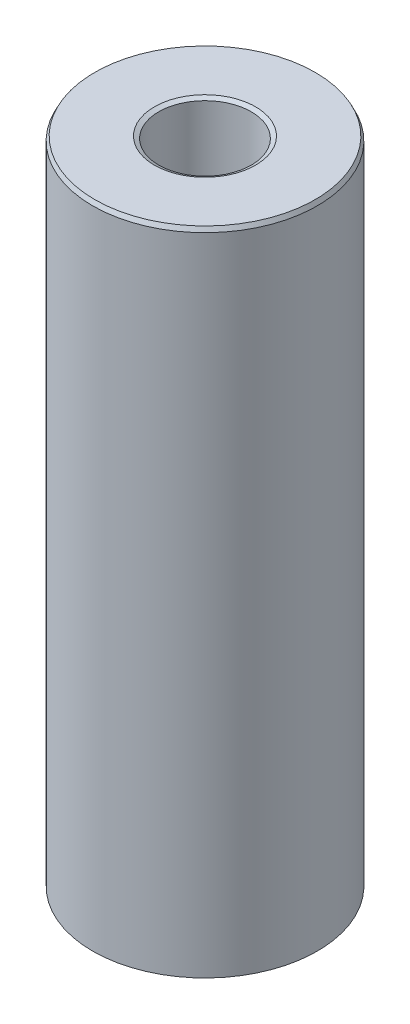
from build123d import *
from OCP.BRepFilletAPI import BRepFilletAPI_MakeChamfer

# Parameters (mm, degrees)
SKETCH1_R           = 32.5
BOSS_EXTRUDE1_DEPTH = 188.569213853
SKETCH2_R           = 13.38316823
CUT_EXTRUDE1_DEPTH  = 195.089794716
CHAMFER1_SIZE       = 1.249627912
CHAMFER1_SIZE2      = 0.614177343


with BuildPart() as part:
    # Sketch1 → Boss-Extrude1 (new body)
    with BuildSketch(Plane(origin=(0, 0, 0), x_dir=(1, 0, 0), z_dir=(0, 1, 0))):
        Circle(SKETCH1_R)
    extrude(amount=BOSS_EXTRUDE1_DEPTH)

    # Sketch2 → Cut-Extrude1 (cut, through all)
    with BuildSketch(Plane(origin=(0, 0, 0), x_dir=(1, 0, 0), z_dir=(0, 1, 0))):
        Circle(SKETCH2_R)
    extrude(amount=CUT_EXTRUDE1_DEPTH, mode=Mode.SUBTRACT)

    # Chamfer1: one chamfer whose edges measure the first distance from different faces: ONE call of the kernel's chamfer builder (chamfer() names one face for all edges)
    chamfer1_edges_1 = [part.edges().sort_by_distance(p)[0] for p in [
        (-13.38316823, 188.569213853, 0),
    ]]
    chamfer1_side_1 = [part.faces().sort_by_distance(p)[0] for p in [
        (-31.580761184, 188.569213853, 0),
    ]]
    chamfer1_edges_2 = [part.edges().sort_by_distance(p)[0] for p in [
        (-13.38316823, 0, 0),
    ]]
    chamfer1_side_2 = [part.faces().sort_by_distance(p)[0] for p in [
        (-13.38316823, 94.284606926, 0),
    ]]
    chamfer1_edges_3 = [part.edges().sort_by_distance(p)[0] for p in [
        (-32.5, 0, 0),
    ]]
    chamfer1_side_3 = [part.faces().sort_by_distance(p)[0] for p in [
        (-31.580761184, 0, 0),
    ]]
    chamfer1_edges_4 = [part.edges().sort_by_distance(p)[0] for p in [
        (-32.5, 188.569213853, 0),
    ]]
    chamfer1_side_4 = [part.faces().sort_by_distance(p)[0] for p in [
        (-32.5, 94.284606926, 0),
    ]]
    chamfer1 = BRepFilletAPI_MakeChamfer(part.part.solid().wrapped)
    for e in chamfer1_edges_1:
        chamfer1.Add(CHAMFER1_SIZE, CHAMFER1_SIZE2, e.wrapped, chamfer1_side_1[0].wrapped)  # the first distance lies on this face
    for e in chamfer1_edges_2:
        chamfer1.Add(CHAMFER1_SIZE, CHAMFER1_SIZE2, e.wrapped, chamfer1_side_2[0].wrapped)  # the first distance lies on this face
    for e in chamfer1_edges_3:
        chamfer1.Add(CHAMFER1_SIZE, CHAMFER1_SIZE2, e.wrapped, chamfer1_side_3[0].wrapped)  # the first distance lies on this face
    for e in chamfer1_edges_4:
        chamfer1.Add(CHAMFER1_SIZE, CHAMFER1_SIZE2, e.wrapped, chamfer1_side_4[0].wrapped)  # the first distance lies on this face
    add(Compound.cast(chamfer1.Shape()), mode=Mode.REPLACE)


solid = part.part
